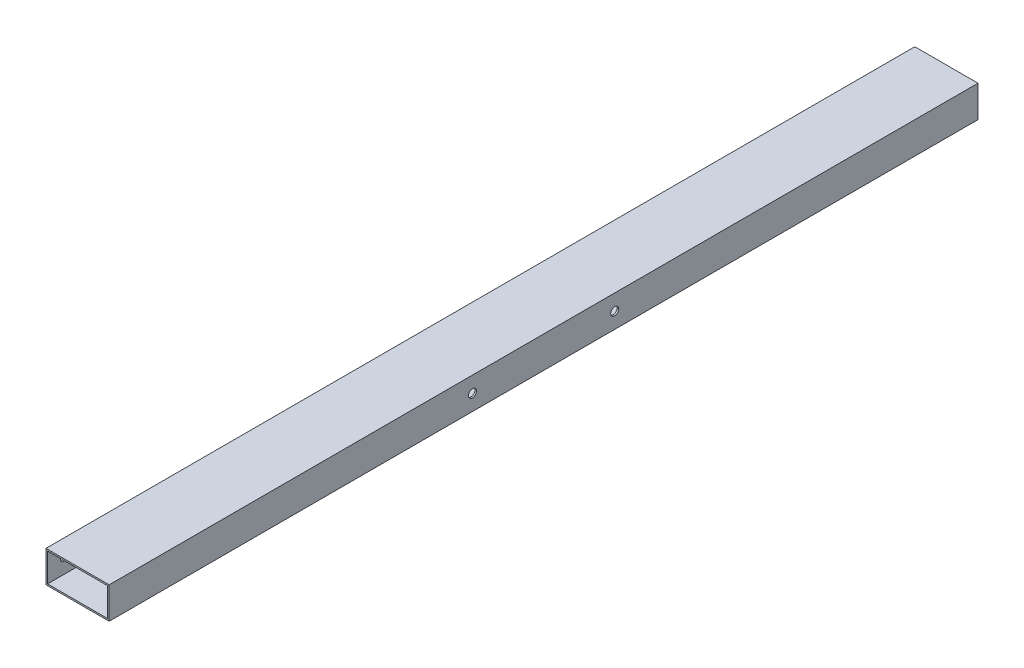
from build123d import *

# Parameters (mm, degrees)
SKETCH_1_W          = 40
SKETCH_1_H          = 20
SKETCH_1_W_2        = 38
SKETCH_1_H_2        = 18
EXTRUDE_1_DEPTH     = 550
SKETCH_4_R          = 1.75
CUT_EXTRUDE_2_DEPTH = 1.5
SKETCH_6_R          = 2.5
CUT_EXTRUDE_3_DEPTH = 552.815186453


with BuildPart() as part:
    # 草图1 → 拉伸-薄壁1 (new body)
    with BuildSketch(Plane.XY):
        with Locations((20, -10)):
            Rectangle(SKETCH_1_W, SKETCH_1_H)
        with Locations((20, -10)):
            Rectangle(SKETCH_1_W_2, SKETCH_1_H_2, mode=Mode.SUBTRACT)
    extrude(amount=EXTRUDE_1_DEPTH)

    # 草图4 → 切除-拉伸2 (cut)
    with BuildSketch(Plane.ZY):
        with Locations((539.996387591, -10)):
            Circle(SKETCH_4_R)
        with Locations((10, -10.000000002)):
            Circle(SKETCH_4_R)
    extrude(amount=-CUT_EXTRUDE_2_DEPTH, mode=Mode.SUBTRACT)

    # 草图6 → 切除-拉伸3 (cut, through all)
    with BuildSketch(Plane(origin=(40, 0, 0), x_dir=(0, 0, -1), z_dir=(1, 0, 0))):
        with Locations((-320, -10)):
            Circle(SKETCH_6_R)
        with Locations((-230, -10)):
            Circle(SKETCH_6_R)
    extrude(amount=-CUT_EXTRUDE_3_DEPTH, mode=Mode.SUBTRACT)


solid = part.part
